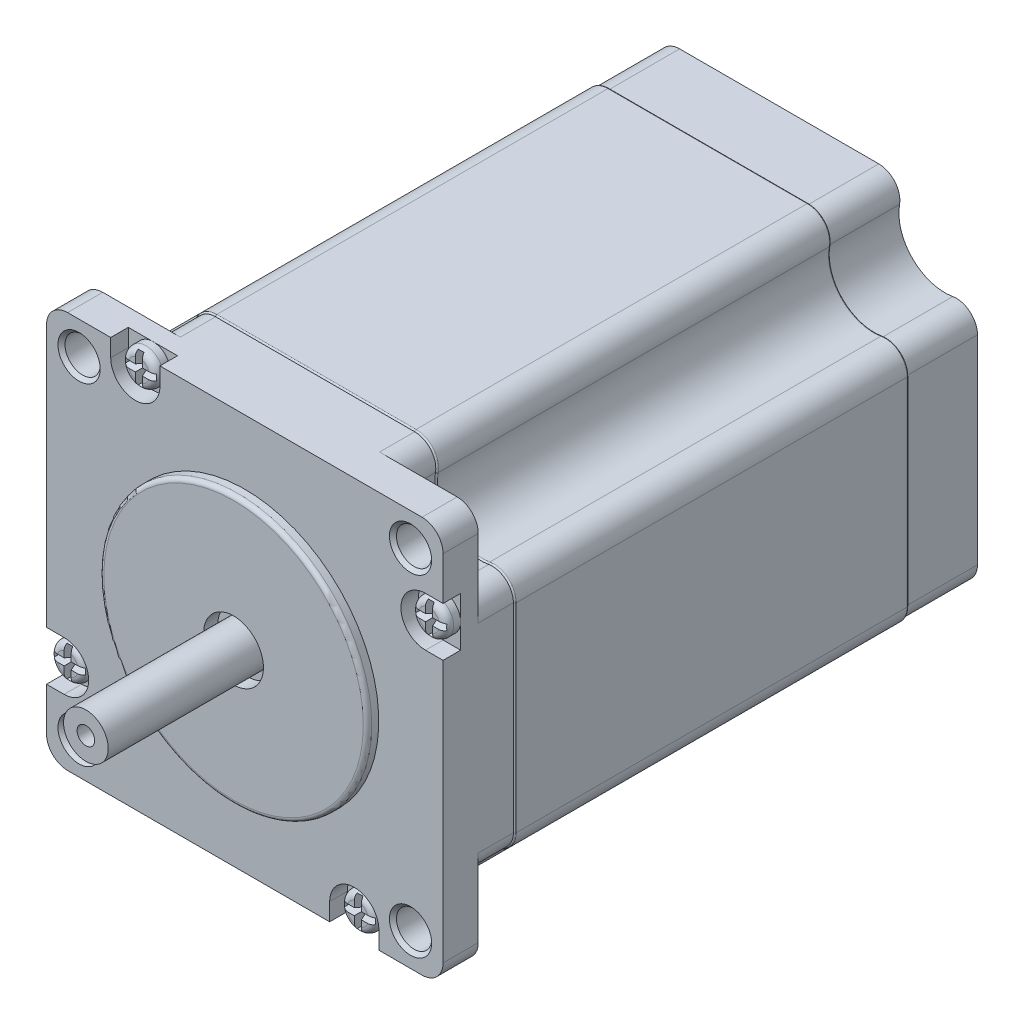
from build123d import *

# Parameters (mm, degrees)
SKETCH1_W                = 56.4
SKETCH1_H                = 56.4
BOSS_EXTRUDE1_DEPTH      = 76
CUT_EXTRUDE1_REACH       = 112.172
SKETCH2_R                = 2.5
SKETCH3_R                = 6.547808794
CUT_EXTRUDE2_DEPTH       = 71
FILLET1_R                = 3
SKETCH4_R                = 19.05
BOSS_EXTRUDE2_DEPTH      = 1.6
FILLET2_R                = 0.6
SKETCH5_R                = 3.175
SKETCH5_R_2              = 1.25
BOSS_EXTRUDE3_DEPTH      = 21
CUT_EXTRUDE3_START       = -2
SKETCH6_R                = 4.25
SKETCH6_R_2              = 3.175
CUT_EXTRUDE3_DEPTH       = 2
BOSS_EXTRUDE4_DEPTH      = 56
FILLET4_R                = 0.2
CHAMFER1_SIZE            = 0.5
CUT_EXTRUDE4_DEPTH       = 2.5
SKETCH10_R               = 2.5
BOSS_EXTRUDE5_DEPTH      = 2
CUT_EXTRUDE5_DEPTH       = 1.5
CUT_EXTRUDE5_DRAFT       = -16
FILLET5_R                = 1
CIRPATTERN3_COUNT        = 4
CIRPATTERN4_COUNT        = 4
CIRPATTERN4_COPY_1_DEPTH = 1.5
CIRPATTERN4_COPY_1_DRAFT = -16
CIRPATTERN4_COPY_2_DEPTH = 1.5
CIRPATTERN4_COPY_2_DRAFT = -16
CIRPATTERN4_COPY_3_DEPTH = 1.5
CIRPATTERN4_COPY_3_DRAFT = -16
FILLET5_OF_CIRPATTERN4_R = 1


# Some blends are built 0.0001 mm under size
with BuildPart() as part:
    # Sketch1 → Boss-Extrude1 (new body)
    with BuildSketch(Plane.XY):
        with Locations((28.2, 28.2)):
            Rectangle(SKETCH1_W, SKETCH1_H)
    extrude(amount=BOSS_EXTRUDE1_DEPTH)

    # Sketch2 → Cut-Extrude1 (cut, up to next)
    with BuildSketch(Plane.XY.offset(76), mode=Mode.PRIVATE) as cut_extrude1_sk1:
        with Locations((4.63, 51.77)):
            Circle(SKETCH2_R)
    cut_extrude1_tool1 = extrude(cut_extrude1_sk1.sketch, amount=-CUT_EXTRUDE1_REACH, mode=Mode.PRIVATE) & part.part
    # Sketch2 → Cut-Extrude1 (cut, up to next)
    with BuildSketch(Plane.XY.offset(76), mode=Mode.PRIVATE) as cut_extrude1_sk2:
        with Locations(Location((51.77, 51.77, 0), (0, 0, 180))):
            Circle(SKETCH2_R)
    cut_extrude1_tool2 = extrude(cut_extrude1_sk2.sketch, amount=-CUT_EXTRUDE1_REACH, mode=Mode.PRIVATE) & part.part
    # Sketch2 → Cut-Extrude1 (cut, up to next)
    with BuildSketch(Plane.XY.offset(76), mode=Mode.PRIVATE) as cut_extrude1_sk3:
        with Locations((51.77, 4.63)):
            Circle(SKETCH2_R)
    cut_extrude1_tool3 = extrude(cut_extrude1_sk3.sketch, amount=-CUT_EXTRUDE1_REACH, mode=Mode.PRIVATE) & part.part
    # Sketch2 → Cut-Extrude1 (cut, up to next)
    with BuildSketch(Plane.XY.offset(76), mode=Mode.PRIVATE) as cut_extrude1_sk4:
        with Locations(Location((4.63, 4.63, 0), (0, 0, 180))):
            Circle(SKETCH2_R)
    cut_extrude1_tool4 = extrude(cut_extrude1_sk4.sketch, amount=-CUT_EXTRUDE1_REACH, mode=Mode.PRIVATE) & part.part
    add(cut_extrude1_tool1.solids().sort_by_distance((4.63, 51.77, 76))[0], mode=Mode.SUBTRACT)
    add(cut_extrude1_tool2.solids().sort_by_distance((51.77, 51.77, 76))[0], mode=Mode.SUBTRACT)
    add(cut_extrude1_tool3.solids().sort_by_distance((51.77, 4.63, 76))[0], mode=Mode.SUBTRACT)
    add(cut_extrude1_tool4.solids().sort_by_distance((4.63, 4.63, 76))[0], mode=Mode.SUBTRACT)

    # Sketch3 → Cut-Extrude2 (cut)
    with BuildSketch(Plane(origin=(0, 0, 0), x_dir=(-1, 0, 0), z_dir=(0, 0, -1))):
        with Locations((-51.77, 51.77)):
            Circle(SKETCH3_R)
        with Locations((-4.63, 51.77)):
            Circle(SKETCH3_R)
        with Locations((-4.63, 4.63)):
            Circle(SKETCH3_R)
        with Locations((-51.77, 4.63)):
            Circle(SKETCH3_R)
    extrude(amount=-CUT_EXTRUDE2_DEPTH, mode=Mode.SUBTRACT)

    # Fillet1
    fillet1_edges = [part.edges().sort_by_distance(p)[0] for p in [
        (56.4, 47.14, 35.5),
        (47.14, 56.4, 35.5),
        (0, 47.14, 35.5),
        (9.26, 56.4, 35.5),
        (0, 9.26, 35.5),
        (9.26, 0, 35.5),
        (47.14, 0, 35.5),
        (56.4, 9.26, 35.5),
        (0, 56.4, 73.5),
        (56.4, 56.4, 73.5),
        (56.4, 0, 73.5),
        (0, 0, 73.5),
    ]]
    fillet(fillet1_edges, radius=FILLET1_R)

    # Sketch4 → Boss-Extrude2 (add)
    with BuildSketch(Plane.XY.offset(76)):
        with Locations(Location((28.2, 28.2, 0), (0, 0, 180))):
            Circle(SKETCH4_R)
    extrude(amount=BOSS_EXTRUDE2_DEPTH)

    # Fillet2
    fillet2_edges = [part.edges().sort_by_distance(p)[0] for p in [
        (47.25, 28.2, 77.6),
    ]]
    fillet(fillet2_edges, radius=FILLET2_R)

    # Sketch5 → Boss-Extrude3 (add)
    with BuildSketch(Plane.XY.offset(77.6)):
        with Locations(Location((28.2, 28.2, 0), (0, 0, 180))):
            Circle(SKETCH5_R)
        with Locations(Location((28.2, 28.2, 0), (0, 0, 180))):
            Circle(SKETCH5_R_2, mode=Mode.SUBTRACT)
    extrude(amount=BOSS_EXTRUDE3_DEPTH)

    # Sketch6 → Cut-Extrude3 (cut)
    with BuildSketch(Plane.XY.offset(77.6).offset(CUT_EXTRUDE3_START)):
        with Locations((28.2, 28.2)):
            Circle(SKETCH6_R)
        with Locations(Location((28.2, 28.2, 0), (0, 0, 180))):
            Circle(SKETCH6_R_2, mode=Mode.SUBTRACT)
    extrude(amount=CUT_EXTRUDE3_DEPTH, mode=Mode.SUBTRACT)

    # Sketch7 → Boss-Extrude4 (add)
    with BuildSketch(Plane(origin=(0, 0, 10), x_dir=(-1, 0, 0), z_dir=(0, 0, -1))):
        with BuildLine():
            ThreePointArc((-52.853696643, 45.515379462), (-47.281421356, 47.281421356), (-45.515379462, 52.853696643))
            ThreePointArc((-45.515379462, 52.853696643), (-44.810638811, 55.460561726), (-42.362356684, 56.6))
            Line((-42.362356684, 56.6), (-14.037643316, 56.6))
            ThreePointArc((-14.037643316, 56.6), (-11.589361189, 55.460561726), (-10.884620538, 52.853696643))
            ThreePointArc((-10.884620538, 52.853696643), (-9.118578644, 47.281421356), (-3.546303357, 45.515379462))
            ThreePointArc((-3.546303357, 45.515379462), (-0.939438274, 44.810638811), (0.2, 42.362356684))
            Line((0.2, 42.362356684), (0.2, 14.037643316))
            ThreePointArc((0.2, 14.037643316), (-0.939438274, 11.589361189), (-3.546303357, 10.884620538))
            ThreePointArc((-3.546303357, 10.884620538), (-9.118578644, 9.118578644), (-10.884620538, 3.546303357))
            ThreePointArc((-10.884620538, 3.546303357), (-11.589361189, 0.939438274), (-14.037643316, -0.2))
            Line((-14.037643316, -0.2), (-42.362356684, -0.2))
            ThreePointArc((-42.362356684, -0.2), (-44.810638811, 0.939438274), (-45.515379462, 3.546303357))
            ThreePointArc((-45.515379462, 3.546303357), (-47.281421356, 9.118578644), (-52.853696643, 10.884620538))
            ThreePointArc((-52.853696643, 10.884620538), (-55.460561726, 11.589361189), (-56.6, 14.037643316))
            Line((-56.6, 14.037643316), (-56.6, 42.362356684))
            ThreePointArc((-56.6, 42.362356684), (-55.460561726, 44.810638811), (-52.853696643, 45.515379462))
        make_face()
        with BuildLine():
            ThreePointArc((-45.318315539, 3.512159398), (-44.657621178, 1.068223382), (-42.362356684, 0))
            Line((-42.362356684, 0), (-14.037643316, 0))
            ThreePointArc((-14.037643316, 0), (-11.742378822, 1.068223382), (-11.081684461, 3.512159398))
            ThreePointArc((-11.081684461, 3.512159398), (-9.26, 9.26), (-3.512159398, 11.081684461))
            ThreePointArc((-3.512159398, 11.081684461), (-1.068223382, 11.742378822), (0, 14.037643316))
            Line((0, 14.037643316), (0, 42.362356684))
            ThreePointArc((0, 42.362356684), (-1.068223382, 44.657621178), (-3.512159398, 45.318315539))
            ThreePointArc((-3.512159398, 45.318315539), (-9.26, 47.14), (-11.081684461, 52.887840602))
            ThreePointArc((-11.081684461, 52.887840602), (-11.742378822, 55.331776618), (-14.037643316, 56.4))
            Line((-14.037643316, 56.4), (-42.362356684, 56.4))
            ThreePointArc((-42.362356684, 56.4), (-44.657621178, 55.331776618), (-45.318315539, 52.887840602))
            ThreePointArc((-45.318315539, 52.887840602), (-47.14, 47.14), (-52.887840602, 45.318315539))
            ThreePointArc((-52.887840602, 45.318315539), (-55.331776618, 44.657621178), (-56.4, 42.362356684))
            Line((-56.4, 42.362356684), (-56.4, 14.037643316))
            ThreePointArc((-56.4, 14.037643316), (-55.331776618, 11.742378822), (-52.887840602, 11.081684461))
            ThreePointArc((-52.887840602, 11.081684461), (-47.14, 9.26), (-45.318315539, 3.512159398))
        make_face(mode=Mode.SUBTRACT)
    extrude(amount=-BOSS_EXTRUDE4_DEPTH)

    # Fillet4
    fillet4_edges = [part.edges().sort_by_distance(p)[0] for p in [
        (47.281421356, 47.281421356, 10),
        (44.810638811, 55.460561726, 66),
        (28.2, 56.6, 66),
        (11.589361189, 55.460561726, 66),
        (9.118578644, 47.281421356, 10),
        (0.939438274, 44.810638811, 66),
        (-0.2, 28.2, 66),
        (0.939438274, 11.589361189, 66),
        (9.118578644, 9.118578644, 10),
        (11.589361189, 0.939438274, 66),
        (28.2, -0.2, 66),
        (44.810638811, 0.939438274, 66),
        (47.281421356, 9.118578644, 10),
        (55.460561726, 11.589361189, 66),
        (56.6, 28.2, 66),
        (55.460561726, 44.810638811, 66),
        (47.281421356, 47.281421356, 66),
        (9.118578644, 47.281421356, 66),
        (9.118578644, 9.118578644, 66),
        (47.281421356, 9.118578644, 66),
        (55.460561726, 44.810638811, 10),
        (56.6, 28.2, 10),
        (55.460561726, 11.589361189, 10),
        (44.810638811, 0.939438274, 10),
        (28.2, -0.2, 10),
        (11.589361189, 0.939438274, 10),
        (0.939438274, 11.589361189, 10),
        (-0.2, 28.2, 10),
        (0.939438274, 44.810638811, 10),
        (11.589361189, 55.460561726, 10),
        (28.2, 56.6, 10),
        (44.810638811, 55.460561726, 10),
    ]]
    fillet(fillet4_edges, radius=FILLET4_R - 0.0001)  # a hair under: the kernel refuses the full size

    # Chamfer1
    chamfer1_edges = [part.edges().sort_by_distance(p)[0] for p in [
        (2.13, 51.77, 76),
        (54.27, 51.77, 76),
        (49.27, 4.63, 76),
        (7.13, 4.63, 76),
    ]]
    chamfer(chamfer1_edges, length=CHAMFER1_SIZE)

    # Sketch8 → Cut-Extrude4 (cut)
    with BuildSketch(Plane.XY.offset(76)):
        with BuildLine():
            Line((9.13, 53.9), (9.13, 56.4))
            Line((9.13, 56.4), (16.13, 56.4))
            Line((16.13, 56.4), (16.13, 53.9))
            ThreePointArc((16.13, 53.9), (12.63, 50.4), (9.13, 53.9))
        make_face()
    cut_extrude4 = extrude(amount=-CUT_EXTRUDE4_DEPTH, mode=Mode.SUBTRACT)

    # Sketch10 → Boss-Extrude5 (add)
    with BuildSketch(Plane.XY.offset(73.5)):
        with Locations(Location((12.63, 53.9, 0), (0, 0, 90))):
            Circle(SKETCH10_R)
    boss_extrude5 = extrude(amount=BOSS_EXTRUDE5_DEPTH)


with BuildPart() as cut_extrude5_tool:
    # Sketch11 → Cut-Extrude5 (with draft: the straight prism first)
    with BuildSketch(Plane.XY.offset(75.5)):
        Polygon((10.33, 53.4), (12.13, 53.4), (12.13, 51.6), (13.13, 51.6), (13.13, 53.4), (14.93, 53.4), (14.93, 54.4), (13.13, 54.4), (13.13, 56.2), (12.13, 56.2), (12.13, 54.4), (10.33, 54.4), align=None)
    extrude(amount=-CUT_EXTRUDE5_DEPTH)
    # Cut-Extrude5: the draft: its side faces are tilted about the plane it starts from
    cut_extrude5_sides = [cut_extrude5_tool.faces().sort_by_distance(p)[0] for p in [
        (11.23, 53.4, 74.75),
        (12.13, 52.5, 74.75),
        (12.63, 51.6, 74.75),
        (13.13, 52.5, 74.75),
        (14.03, 53.4, 74.75),
        (14.93, 53.9, 74.75),
        (14.03, 54.4, 74.75),
        (13.13, 55.3, 74.75),
        (12.63, 56.2, 74.75),
        (12.13, 55.3, 74.75),
        (11.23, 54.4, 74.75),
        (10.33, 53.9, 74.75),
    ]]
    draft(cut_extrude5_sides, Plane.XY.offset(75.5), CUT_EXTRUDE5_DRAFT)


with BuildPart() as part_1:
    add(part.part)

    # Cut-Extrude5: cut by cut_extrude5_tool
    add(cut_extrude5_tool.part, mode=Mode.SUBTRACT)

    # Fillet5
    # the kernel refuses this fillet: 1 mm, written as the material it takes off along each edge
    with BuildSketch(Plane(origin=(12.63, 53.9, 75.5), x_dir=(0, 1, 0), z_dir=(1, 0, 0))) as fillet5_piece_1:
        with BuildLine():
            CenterArc((2.5 - FILLET5_R, -FILLET5_R), FILLET5_R, 0, 90)
            Line((2.5 - FILLET5_R, 0), (2.5, 0))
            Line((2.5, 0), (2.5, -FILLET5_R))
        make_face()
    revolve(axis=Axis((12.63, 53.9, 75.5), (0, 0, 1)), mode=Mode.SUBTRACT)

    # CirPattern3: Cut-Extrude4 ×4 about axis
    cirpattern3_axis = Axis((28.2, 28.2, 0), (0, 0, 1))
    for i in range(1, CIRPATTERN3_COUNT):
        add(cut_extrude4.rotate(cirpattern3_axis, i * 360 / CIRPATTERN3_COUNT), mode=Mode.SUBTRACT)

    # CirPattern4: Boss-Extrude5 ×4 about axis
    cirpattern4_axis = Axis((28.2, 28.2, 0), (0, 0, 1))
    for i in range(1, CIRPATTERN4_COUNT):
        add(boss_extrude5.rotate(cirpattern4_axis, i * 360 / CIRPATTERN4_COUNT))


with BuildPart() as cirpattern4_copy_1_tool:
    # CirPattern4 copy 1 sketch → CirPattern4 copy 1 (with draft: the straight prism first)
    with BuildSketch(Plane(origin=(56.4, 0, 75.5), x_dir=(0, 1, 0), z_dir=(0, 0, 1))):
        Polygon((10.33, 53.4), (12.13, 53.4), (12.13, 51.6), (13.13, 51.6), (13.13, 53.4), (14.93, 53.4), (14.93, 54.4), (13.13, 54.4), (13.13, 56.2), (12.13, 56.2), (12.13, 54.4), (10.33, 54.4), align=None)
    extrude(amount=-CIRPATTERN4_COPY_1_DEPTH)
    # CirPattern4 copy 1: the draft: its side faces are tilted about the plane it starts from
    cirpattern4_copy_1_sides = [cirpattern4_copy_1_tool.faces().sort_by_distance(p)[0] for p in [
        (3, 11.23, 74.75),
        (3.9, 12.13, 74.75),
        (4.8, 12.63, 74.75),
        (3.9, 13.13, 74.75),
        (3, 14.03, 74.75),
        (2.5, 14.93, 74.75),
        (2, 14.03, 74.75),
        (1.1, 13.13, 74.75),
        (0.2, 12.63, 74.75),
        (1.1, 12.13, 74.75),
        (2, 11.23, 74.75),
        (2.5, 10.33, 74.75),
    ]]
    draft(cirpattern4_copy_1_sides, Plane(origin=(56.4, 0, 75.5), x_dir=(0, 1, 0), z_dir=(0, 0, 1)), CIRPATTERN4_COPY_1_DRAFT)


with BuildPart() as part_2:
    add(part_1.part)

    # CirPattern4 copy 1: cut by cirpattern4_copy_1_tool
    add(cirpattern4_copy_1_tool.part, mode=Mode.SUBTRACT)


with BuildPart() as cirpattern4_copy_2_tool:
    # CirPattern4 copy 2 sketch → CirPattern4 copy 2 (with draft: the straight prism first)
    with BuildSketch(Plane(origin=(56.4, 56.4, 75.5), x_dir=(-1, 0, 0), z_dir=(0, 0, 1))):
        Polygon((10.33, 53.4), (12.13, 53.4), (12.13, 51.6), (13.13, 51.6), (13.13, 53.4), (14.93, 53.4), (14.93, 54.4), (13.13, 54.4), (13.13, 56.2), (12.13, 56.2), (12.13, 54.4), (10.33, 54.4), align=None)
    extrude(amount=-CIRPATTERN4_COPY_2_DEPTH)
    # CirPattern4 copy 2: the draft: its side faces are tilted about the plane it starts from
    cirpattern4_copy_2_sides = [cirpattern4_copy_2_tool.faces().sort_by_distance(p)[0] for p in [
        (45.17, 3, 74.75),
        (44.27, 3.9, 74.75),
        (43.77, 4.8, 74.75),
        (43.27, 3.9, 74.75),
        (42.37, 3, 74.75),
        (41.47, 2.5, 74.75),
        (42.37, 2, 74.75),
        (43.27, 1.1, 74.75),
        (43.77, 0.2, 74.75),
        (44.27, 1.1, 74.75),
        (45.17, 2, 74.75),
        (46.07, 2.5, 74.75),
    ]]
    draft(cirpattern4_copy_2_sides, Plane(origin=(56.4, 56.4, 75.5), x_dir=(-1, 0, 0), z_dir=(0, 0, 1)), CIRPATTERN4_COPY_2_DRAFT)


with BuildPart() as part_3:
    add(part_2.part)

    # CirPattern4 copy 2: cut by cirpattern4_copy_2_tool
    add(cirpattern4_copy_2_tool.part, mode=Mode.SUBTRACT)


with BuildPart() as cirpattern4_copy_3_tool:
    # CirPattern4 copy 3 sketch → CirPattern4 copy 3 (with draft: the straight prism first)
    with BuildSketch(Plane(origin=(0, 56.4, 75.5), x_dir=(0, -1, 0), z_dir=(0, 0, 1))):
        Polygon((10.33, 53.4), (12.13, 53.4), (12.13, 51.6), (13.13, 51.6), (13.13, 53.4), (14.93, 53.4), (14.93, 54.4), (13.13, 54.4), (13.13, 56.2), (12.13, 56.2), (12.13, 54.4), (10.33, 54.4), align=None)
    extrude(amount=-CIRPATTERN4_COPY_3_DEPTH)
    # CirPattern4 copy 3: the draft: its side faces are tilted about the plane it starts from
    cirpattern4_copy_3_sides = [cirpattern4_copy_3_tool.faces().sort_by_distance(p)[0] for p in [
        (53.4, 45.17, 74.75),
        (52.5, 44.27, 74.75),
        (51.6, 43.77, 74.75),
        (52.5, 43.27, 74.75),
        (53.4, 42.37, 74.75),
        (53.9, 41.47, 74.75),
        (54.4, 42.37, 74.75),
        (55.3, 43.27, 74.75),
        (56.2, 43.77, 74.75),
        (55.3, 44.27, 74.75),
        (54.4, 45.17, 74.75),
        (53.9, 46.07, 74.75),
    ]]
    draft(cirpattern4_copy_3_sides, Plane(origin=(0, 56.4, 75.5), x_dir=(0, -1, 0), z_dir=(0, 0, 1)), CIRPATTERN4_COPY_3_DRAFT)


with BuildPart() as part_4:
    add(part_3.part)

    # CirPattern4 copy 3: cut by cirpattern4_copy_3_tool
    add(cirpattern4_copy_3_tool.part, mode=Mode.SUBTRACT)

    # Fillet5 of CirPattern4
    # the kernel refuses this fillet: 1 mm, written as the material it takes off along each edge
    with BuildSketch(Plane(origin=(2.5, 12.63, 75.5), x_dir=(-1, 0, 0), z_dir=(0, 1, 0))) as fillet5_of_cirpattern4_piece_1:
        with BuildLine():
            CenterArc((2.5 - FILLET5_OF_CIRPATTERN4_R, -FILLET5_OF_CIRPATTERN4_R), FILLET5_OF_CIRPATTERN4_R, 0, 90)
            Line((2.5 - FILLET5_OF_CIRPATTERN4_R, 0), (2.5, 0))
            Line((2.5, 0), (2.5, -FILLET5_OF_CIRPATTERN4_R))
        make_face()
    revolve(axis=Axis((2.5, 12.63, 75.5), (0, 0, 1)), mode=Mode.SUBTRACT)
    with BuildSketch(Plane(origin=(43.77, 2.5, 75.5), x_dir=(0, -1, 0), z_dir=(-1, 0, 0))) as fillet5_of_cirpattern4_piece_2:
        with BuildLine():
            CenterArc((2.5 - FILLET5_OF_CIRPATTERN4_R, -FILLET5_OF_CIRPATTERN4_R), FILLET5_OF_CIRPATTERN4_R, 0, 90)
            Line((2.5 - FILLET5_OF_CIRPATTERN4_R, 0), (2.5, 0))
            Line((2.5, 0), (2.5, -FILLET5_OF_CIRPATTERN4_R))
        make_face()
    revolve(axis=Axis((43.77, 2.5, 75.5), (0, 0, 1)), mode=Mode.SUBTRACT)
    with BuildSketch(Plane(origin=(53.9, 43.77, 75.5), x_dir=(1, 0, 0), z_dir=(0, -1, 0))) as fillet5_of_cirpattern4_piece_3:
        with BuildLine():
            CenterArc((2.5 - FILLET5_OF_CIRPATTERN4_R, -FILLET5_OF_CIRPATTERN4_R), FILLET5_OF_CIRPATTERN4_R, 0, 90)
            Line((2.5 - FILLET5_OF_CIRPATTERN4_R, 0), (2.5, 0))
            Line((2.5, 0), (2.5, -FILLET5_OF_CIRPATTERN4_R))
        make_face()
    revolve(axis=Axis((53.9, 43.77, 75.5), (0, 0, 1)), mode=Mode.SUBTRACT)


solid = part_4.part
